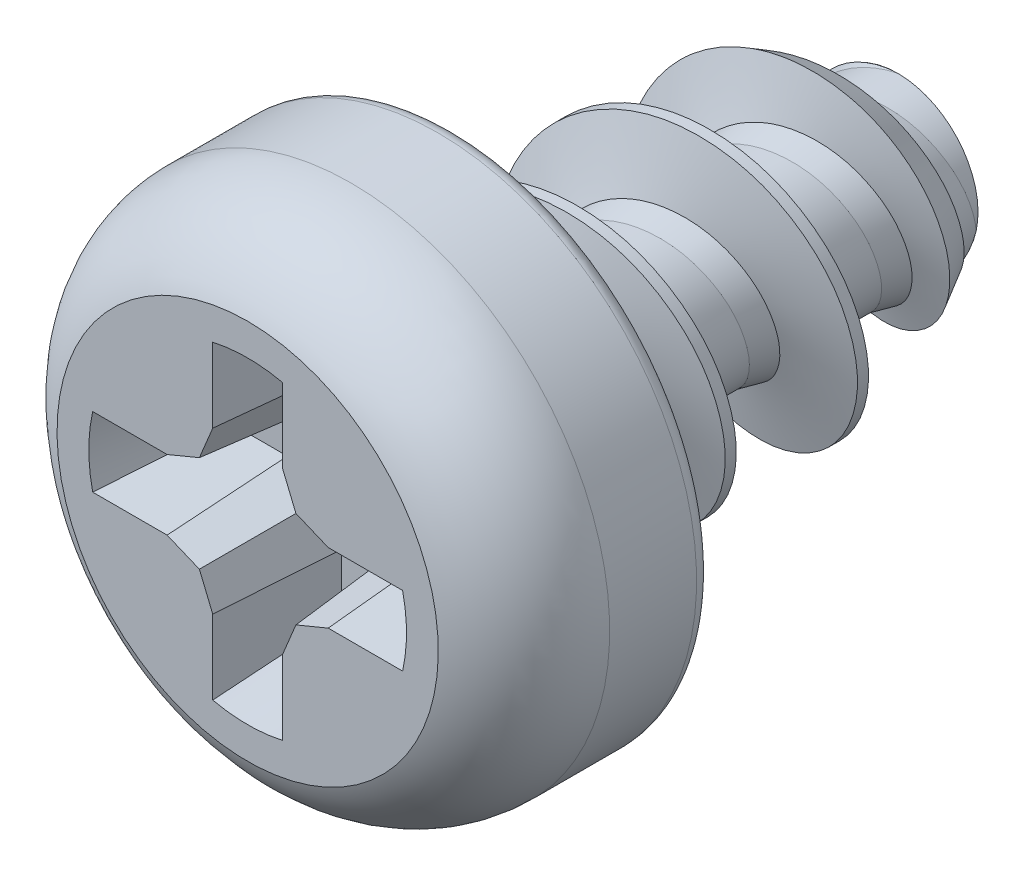
from build123d import *

# Parameters (mm, degrees)
CUT_EXTRUDE1_DEPTH      = 1.6
CIRPATTERN1_COUNT       = 4
DRAFT2_ANGLE            = 5
FILLET1_R               = 0.22375
SWEEP2_PITCH            = 1.79
CUT_EXTRUDE4_DEPTH      = 11.332974563
CUT_EXTRUDE4_DEPTH_BACK = 11.332974563
SKETCH16_W              = 2.8
SKETCH16_H              = 7
SKETCH16_W_2            = 4.475
SKETCH14_R              = 2
BOSS_EXTRUDE3_DEPTH     = 0.3
SKETCH15_R              = 2
BOSS_EXTRUDE4_DEPTH     = 0.9
BOSS_EXTRUDE4_DRAFT     = -39


# Read off the part's stored shape, not the designer's step: Draft1
with BuildPart() as part:
    # Sketch3 → Revolve1 (revolve)
    with BuildSketch(Plane(origin=(0, 0, 0), x_dir=(0, 0, -1), z_dir=(1, 0, 0)), mode=Mode.PRIVATE) as revolve1_sk:
        Polygon((0, 1.085), (0, 3.5), (-2.8, 3.5), (-2.8, 0), (6, 0), (6, 1.085), align=None)
    revolve(revolve1_sk.sketch.rotate(Axis((0, 0, 2.8), (0, 0, -1)), 180), axis=Axis((0, 0, 2.8), (0, 0, -1)))

    # Sketch4 → Cut-Revolve1 (revolve, cut)
    with BuildSketch(Plane(origin=(0, 0, 0), x_dir=(0, 0, -1), z_dir=(1, 0, 0)), mode=Mode.PRIVATE) as cut_revolve1_sk:
        with BuildLine():
            Line((-2.8, 2.58), (-3, 2.58))
            Line((-3, 2.58), (-3, 3.7))
            Line((-3, 3.7), (0, 3.7))
            Line((0, 3.7), (0, 3.5))
            Line((0, 3.5), (-1.4, 3.5))
            ThreePointArc((-1.4, 3.5), (-2.237615664, 3.24941514), (-2.8, 2.58))
        make_face()
    revolve(cut_revolve1_sk.sketch.rotate(Axis((0, 0, 0), (0, 0, 1)), 180), axis=Axis((0, 0, 0), (0, 0, 1)), mode=Mode.SUBTRACT)

    # Sketch5 → Cut-Extrude1 (cut)
    with BuildSketch(Plane.XY.offset(2.8)):
        with BuildLine():
            Line((0, 2.15), (0, 0))
            Line((0, 0), (2.15, 0))
            ThreePointArc((2.15, 0), (2.143523658, 0.1667523), (2.124133647, 0.3325))
            Line((2.124133647, 0.3325), (1.062066823, 0.3325))
            Line((1.062066823, 0.3325), (0.546185175, 0.546185175))
            Line((0.546185175, 0.546185175), (0.3325, 1.062066823))
            Line((0.3325, 1.062066823), (0.3325, 2.124133647))
            ThreePointArc((0.3325, 2.124133647), (0.1667523, 2.143523658), (0, 2.15))
        make_face()
    cut_extrude1 = extrude(amount=-CUT_EXTRUDE1_DEPTH, mode=Mode.SUBTRACT)

    # CirPattern1: Cut-Extrude1 ×4 about axis
    cirpattern1_axis = Axis((0, 0, 0), (0, 0, 1))
    for i in range(1, CIRPATTERN1_COUNT):
        add(cut_extrude1.rotate(cirpattern1_axis, i * 360 / CIRPATTERN1_COUNT), mode=Mode.SUBTRACT)

    # Draft1 outline → Draft1 (revolve)
    with BuildSketch(Plane.XZ):
        Polygon((2.15, 2.8), (1.867876831, 1.2), (2.15, 1.2), align=None)
    revolve(axis=Axis((0, 0, 0), (0, 0, 1)))

    # Draft2
    draft2_faces = [part.faces().sort_by_distance(p)[0] for p in [
        (0.3325, 1.525335581, 2.041500827),
        (0.439342588, 0.804125999, 2),
        (0.804125999, 0.439342588, 2),
        (1.525335581, 0.3325, 2.041500827),
        (1.525335581, -0.3325, 2.041500827),
        (0.804125999, -0.439342588, 2),
        (0.439342588, -0.804125999, 2),
        (0.3325, -1.525335581, 2.041500827),
        (-0.3325, -1.525335581, 2.041500827),
        (-0.439342588, -0.804125999, 2),
        (-0.804125999, -0.439342588, 2),
        (-1.525335581, -0.3325, 2.041500827),
        (-1.525335581, 0.3325, 2.041500827),
        (-0.804125999, 0.439342588, 2),
        (-0.439342588, 0.804125999, 2),
        (-0.3325, 1.525335581, 2.041500827),
    ]]
    draft(draft2_faces, Plane.XY.offset(1.2), DRAFT2_ANGLE)

    # Fillet1
    fillet1_edges = [part.edges().sort_by_distance(p)[0] for p in [
        (0, 3.5, 0),
    ]]
    fillet(fillet1_edges, radius=FILLET1_R)


with BuildPart() as body_2:
    # Split1: the piece on the far side of the plane
    add(part.part)
    split(bisect_by=Plane.XY, keep=Keep.BOTTOM)

    # Sweep2: the profile of Sketch9 screwed along a right-hand helix of 5.351955 turns, 10 arcs to a turn; built about Z, then put on its axis
    sweep2_z = Axis((0, 0, 0), (0, 0, 1))
    sweep2_corners = [(2, 0, -0.565567163), (2, 0, -0.71473383), (1.159583333, 0, -0.939922797), (1.085, 0, -1.280300993), (0.837360895, 0, -1.280300993), (0.837360895, 0, 0), (1.085, 0, 0), (1.159583333, 0, -0.340378196)]
    with BuildLine(mode=Mode.PRIVATE) as sweep2_profile:
        Line(sweep2_corners[0], sweep2_corners[1])
        Line(sweep2_corners[1], sweep2_corners[2])
        Line(sweep2_corners[2], sweep2_corners[3])
        Line(sweep2_corners[3], sweep2_corners[4])
        Line(sweep2_corners[4], sweep2_corners[5])
        Line(sweep2_corners[5], sweep2_corners[6])
        Line(sweep2_corners[6], sweep2_corners[7])
        Line(sweep2_corners[7], sweep2_corners[0])
    sweep2_cap = Face(sweep2_profile.wire())
    sweep2_turn_angles = [0, 18, 36, 54, 72, 90, 108, 126, 144, 162, 180, 198, 216, 234, 252, 270, 288, 306, 324, 342, 360]
    sweep2_turn_weights = [1, 0.9510565162951535, 1, 0.9510565162951535, 1, 0.9510565162951535, 1, 0.9510565162951535, 1, 0.9510565162951535, 1, 0.9510565162951535, 1, 0.9510565162951535, 1, 0.9510565162951535, 1, 0.9510565162951535, 1, 0.9510565162951535, 1]
    sweep2_turn_rails = [Edge.make_bspline([Vector(p[0], p[1], 0).rotate(sweep2_z, sweep2_turn_angles[k]) / sweep2_turn_weights[k] + Vector(0, 0, p[2] + SWEEP2_PITCH * sweep2_turn_angles[k] / 360) for k in range(21)], [0, 0, 0, 1, 1, 2, 2, 3, 3, 4, 4, 5, 5, 6, 6, 7, 7, 8, 8, 9, 9, 10, 10, 10], 2, sweep2_turn_weights) for p in sweep2_corners]
    sweep2_turn_sides = [Face.make_surface_from_curves(sweep2_turn_rails[p[0]], sweep2_turn_rails[p[1]]) for p in [(0, 1), (1, 2), (2, 3), (3, 4), (4, 5), (5, 6), (6, 7), (7, 0)]]
    sweep2_last_angles = [1800, 1818, 1836, 1854, 1872, 1890, 1908, 1917.351955307, 1926.703910615]
    sweep2_last_weights = [1, 0.9510565162951535, 1, 0.9510565162951535, 1, 0.9510565162951535, 1, 0.986708769776949, 1]
    sweep2_last_rails = [Edge.make_bspline([Vector(p[0], p[1], 0).rotate(sweep2_z, sweep2_last_angles[k]) / sweep2_last_weights[k] + Vector(0, 0, p[2] + SWEEP2_PITCH * sweep2_last_angles[k] / 360) for k in range(9)], [0, 0, 0, 1, 1, 2, 2, 3, 3, 4, 4, 4], 2, sweep2_last_weights) for p in sweep2_corners]
    sweep2_last_sides = [Face.make_surface_from_curves(sweep2_last_rails[p[0]], sweep2_last_rails[p[1]]) for p in [(0, 1), (1, 2), (2, 3), (3, 4), (4, 5), (5, 6), (6, 7), (7, 0)]]
    sweep2 = Plane(origin=(0, 0, -7.79), x_dir=(0, 1, 0), z_dir=(0, 0, 1)) * Solid(Shell([*[p.moved(Location((0, 0, SWEEP2_PITCH * i))) for i in range(5) for p in sweep2_turn_sides], *sweep2_last_sides, sweep2_cap, sweep2_cap.rotate(sweep2_z, 1926.703910615).moved(Location((0, 0, SWEEP2_PITCH * 1926.703910615 / 360)))]))
    add(sweep2)

    # Sketch16 → Cut-Extrude4 (cut, two sides: drawn at the far end of the back side and taken through both)
    with BuildSketch(Plane(origin=(0, 0, 0), x_dir=(0, 0, -1), z_dir=(1, 0, 0)).offset(-CUT_EXTRUDE4_DEPTH_BACK)):
        with Locations((-1.4, 0)):
            Rectangle(SKETCH16_W, SKETCH16_H)
        with Locations((8.2375, 0)):
            Rectangle(SKETCH16_W_2, SKETCH16_H)
    extrude(amount=CUT_EXTRUDE4_DEPTH + CUT_EXTRUDE4_DEPTH_BACK, mode=Mode.SUBTRACT)

    # Sketch13 → Cut-Revolve2 (revolve, cut)
    with BuildSketch(Plane(origin=(0, 0, 0), x_dir=(0, 0, -1), z_dir=(1, 0, 0))):
        Polygon((6, 3.5), (6, 1.085), (1.731501951, 3.5), align=None)
    revolve(axis=Axis((0, 0, 0), (0, 0, -1)), mode=Mode.SUBTRACT)


with BuildPart() as part_1:
    add(part.part)

    # Split1
    split(bisect_by=Plane.XY, keep=Keep.TOP)

    add(body_2.part)  # Boss-Extrude3 merges body 2
    # Sketch14 → Boss-Extrude3 (add)
    with BuildSketch(Plane.XY):
        Circle(SKETCH14_R)
    extrude(amount=-BOSS_EXTRUDE3_DEPTH)


with BuildPart() as boss_extrude4_tool:
    # Sketch15 → Boss-Extrude4 (with draft: the straight prism first)
    with BuildSketch(Plane.XY.offset(-0.3)):
        Circle(SKETCH15_R)
    extrude(amount=-BOSS_EXTRUDE4_DEPTH)
    # Boss-Extrude4: the draft: its side faces are tilted about the plane it starts from
    boss_extrude4_sides = [boss_extrude4_tool.faces().sort_by_distance(p)[0] for p in [
        (-2, 0, -0.75),
    ]]
    draft(boss_extrude4_sides, Plane.XY.offset(-0.3), BOSS_EXTRUDE4_DRAFT)


with BuildPart() as part_2:
    add(part_1.part)

    # Boss-Extrude4: add boss_extrude4_tool
    add(boss_extrude4_tool.part)


solid = part_2.part
